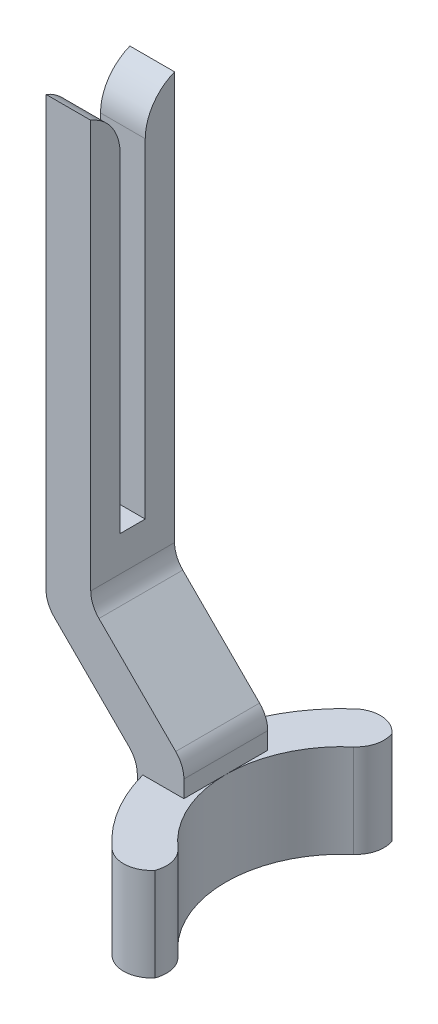
from build123d import *

# Parameters (mm, degrees)
SKETCH1_W             = 4.8
SKETCH1_H             = 3.15
BOSS_EXTRUDE1_DEPTH   = 40
BOSS_EXTRUDE1_2_DEPTH = 40
SKETCH2_W             = 4.8
SKETCH2_H             = 9
BOSS_EXTRUDE2_DEPTH   = 5
BOSS_EXTRUDE3_DEPTH   = 9
BOSS_EXTRUDE4_DEPTH   = 10
FILLET1_R             = 5
FILLET2_R             = 3
FILLET3_R             = 3


with BuildPart() as part:
    # Sketch1 → Boss-Extrude1 (new body)
    with BuildSketch(Plane(origin=(0, 0, 0), x_dir=(1, 0, 0), z_dir=(0, 1, 0))):
        with Locations((2.4, 7.425)):
            Rectangle(SKETCH1_W, SKETCH1_H)
    extrude(amount=BOSS_EXTRUDE1_DEPTH)



with BuildPart() as body_2:
    # Sketch1 → Boss-Extrude1 2 (new body)
    with BuildSketch(Plane(origin=(0, 0, 0), x_dir=(1, 0, 0), z_dir=(0, 1, 0))):
        with Locations((2.4, 1.575)):
            Rectangle(SKETCH1_W, SKETCH1_H)
    extrude(amount=BOSS_EXTRUDE1_2_DEPTH)


with BuildPart() as part_1:
    add(part.part)

    add(body_2.part)  # Boss-Extrude2 merges body 2
    # Sketch2 → Boss-Extrude2 (add)
    with BuildSketch(Plane.XZ):
        with Locations((2.4, -4.5)):
            Rectangle(SKETCH2_W, SKETCH2_H)
    extrude(amount=BOSS_EXTRUDE2_DEPTH)

    # Sketch3 → Boss-Extrude3 (add)
    with BuildSketch(Plane(origin=(4, 0, 0), x_dir=(-1, 0, 0), z_dir=(0, 0, -1))):
        Polygon((-5.8, -17.071067812), (4, -7.271067812), (4, -5), (-0.8, -5), (-10.8, -15), (-10.8, -18.071067812), (-5.8, -18.071067812), align=None)
    extrude(amount=BOSS_EXTRUDE3_DEPTH)

    # Sketch4 → Boss-Extrude4 (add)
    with BuildSketch(Plane.XZ.offset(18.071067812)):
        with BuildLine():
            Line((9.8, 0), (9.8, -4.5))
            ThreePointArc((9.8, -4.5), (9.94774, -2.230843129), (10.388465475, 0))
            Line((10.388465475, 0), (9.8, 0))
        make_face()
        with BuildLine():
            ThreePointArc((10.388465475, -9), (9.94774, -6.769156871), (9.8, -4.5))
            Line((9.8, -4.5), (9.8, -9))
            Line((9.8, -9), (10.388465475, -9))
        make_face()
        with BuildLine():
            ThreePointArc((21.05, -15.325317547), (16.474682453, -10.75), (14.8, -4.5))
            Line((14.8, -4.5), (14.8, -9))
            Line((14.8, -9), (10.388465475, -9))
            ThreePointArc((10.388465475, -9), (13.407080463, -15.141277495), (18.55, -19.655444566))
            Line((18.55, -19.655444566), (21.05, -15.325317547))
        make_face()
        with BuildLine():
            Line((14.8, -9), (14.8, -4.5))
            Line((14.8, -4.5), (9.8, -4.5))
            ThreePointArc((9.8, -4.5), (9.94774, -6.769156871), (10.388465475, -9))
            Line((10.388465475, -9), (14.8, -9))
        make_face()
        with BuildLine():
            Line((9.8, -4.5), (14.8, -4.5))
            Line((14.8, -4.5), (14.8, 0))
            Line((14.8, 0), (10.388465475, 0))
            ThreePointArc((10.388465475, 0), (9.94774, -2.230843129), (9.8, -4.5))
        make_face()
        with BuildLine():
            Line((14.8, 0), (14.8, -4.5))
            ThreePointArc((14.8, -4.5), (16.474682453, 1.75), (21.05, 6.325317547))
            Line((21.05, 6.325317547), (18.55, 10.655444566))
            ThreePointArc((18.55, 10.655444566), (13.407080463, 6.141277495), (10.388465475, 0))
            Line((10.388465475, 0), (14.8, 0))
        make_face()
    extrude(amount=BOSS_EXTRUDE4_DEPTH)

    # Fillet1
    # the kernel refuses this fillet: 5 mm, written as the material it takes off along each edge
    with BuildSketch(Plane(origin=(16.412896925, 40, -3.15), x_dir=(0, 0, 1), z_dir=(-1, 0, 0))) as fillet1_piece_1:
        with BuildLine():
            CenterArc((5, -4.64515877), FILLET1_R, 111.715617283, 68.284382717)
            Line((0, -4.64515877), (-0.1, -4.64515877))
            Line((-0.1, -4.64515877), (-0.1, 0))
            Line((-0.1, 0), (0, 0.1))
            ThreePointArc((0, 0.1), (1.575, 0.1), (3.113, 0.092903175))
            Line((3.113, 0.092903175), (3.15, 0))
        make_face()
    extrude(amount=28.025793851, mode=Mode.SUBTRACT)
    with BuildSketch(Plane(origin=(-11.612896925, 40, -5.85), x_dir=(0, -1, 0), z_dir=(1, 0, 0))) as fillet1_piece_2:
        with BuildLine():
            CenterArc((4.64515877, 5), FILLET1_R, 201.715617283, 68.284382717)
            Line((0, 3.15), (-0.092903175, 3.113))
            ThreePointArc((-0.092903175, 3.113), (-0.1, 1.575), (-0.1, 0))
            Line((-0.1, 0), (0, -0.1))
            Line((0, -0.1), (4.64515877, -0.1))
            Line((4.64515877, -0.1), (4.64515877, 0))
        make_face()
    extrude(amount=28.025793851, mode=Mode.SUBTRACT)

    # Fillet2
    # the kernel refuses this fillet: 3 mm, written as the material it takes off along each edge
    with BuildSketch(Plane(origin=(21.05, -11.303801998, 6.325317547), x_dir=(-0.8133042312871992, 0, -0.581838660945058), z_dir=(0, -1, 0))) as fillet2_piece_1:
        with BuildLine():
            CenterArc((2.722578478, -2.985784367), FILLET2_R, 95.579968436, 78.840063128)
            Line((-0.263205889, -2.69407953), (0, 0))
            ThreePointArc((0, 0), (1.21543682, -0.059231803), (2.430873641, 0))
        make_face()
    extrude(amount=23.534531629, mode=Mode.SUBTRACT)
    with BuildSketch(Plane(origin=(21.05, -11.303801998, -15.325317547), x_dir=(-0.4999999999999966, 0, -0.8660254037844407), z_dir=(0, -1, 0))) as fillet2_piece_2:
        with BuildLine():
            CenterArc((2.706906326, -3), FILLET2_R, 90, 78.840063128)
            ThreePointArc((-0.236365866, -2.419354839), (-0.059231803, -1.21543682), (0, 0))
            Line((0, 0), (2.706906326, 0))
        make_face()
    extrude(amount=23.534531629, mode=Mode.SUBTRACT)
    with BuildSketch(Plane(origin=(18.55, -8.969979336, -19.655444566), x_dir=(-0.8093218589148085, 0, 0.5873654132502858), z_dir=(0, -1, 0))) as fillet2_piece_3:
        with BuildLine():
            CenterArc((3.328398071, -2.983727989), FILLET2_R, 84.02972802, 101.940543961)
            Line((0.344670082, -3.295765308), (0, 0))
            ThreePointArc((0, 0), (1.820217695, 0.094920065), (3.64043539, 0))
        make_face()
    extrude(amount=28.202176951, mode=Mode.SUBTRACT)
    with BuildSketch(Plane(origin=(18.55, -8.969979336, 10.655444566), x_dir=(-0.8093218589148087, 0, -0.5873654132502856), z_dir=(0, -1, 0))) as fillet2_piece_4:
        with BuildLine():
            CenterArc((3.328398071, 2.983727989), FILLET2_R, 174.02972802, 101.940543961)
            Line((0.344670082, 3.295765308), (0, 0))
            ThreePointArc((0, 0), (1.820217695, -0.094920065), (3.64043539, 0))
        make_face()
    extrude(amount=28.202176951, mode=Mode.SUBTRACT)

    # Fillet3
    fillet3_edges = [part_1.edges().sort_by_distance(p)[0] for p in [
        (4.8, -5, -4.5),
        (9.8, -17.071067812, -4.5),
        (0, -7.271067812, -4.5),
        (14.8, -15, -4.5),
    ]]
    fillet(fillet3_edges, radius=FILLET3_R)


solid = part_1.part
